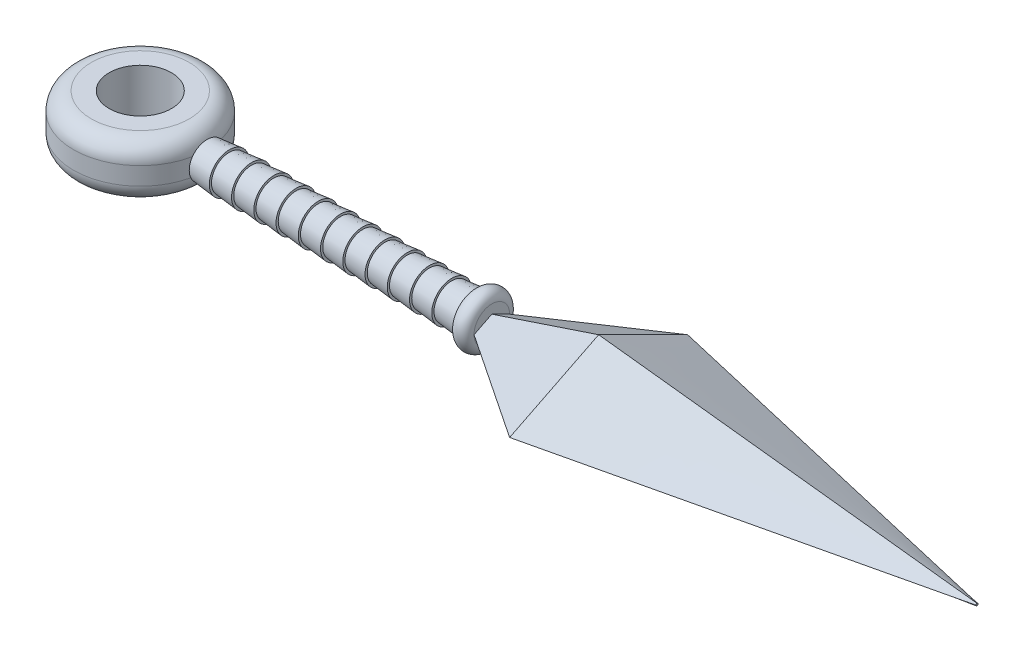
from build123d import *

# Parameters (mm, degrees)
SKETCH1_R           = 15
SKETCH1_R_2         = 7
BOSS_EXTRUDE1_DEPTH = 6
FILLET1_R           = 4


with BuildPart() as part:
    # Sketch1 → Boss-Extrude1 (new, symmetric)
    with BuildSketch(Plane(origin=(0, 0, 0), x_dir=(1, 0, 0), z_dir=(0, 1, 0))):
        with Locations(Location((0, 0, 0), (0, 0, 270))):
            Circle(SKETCH1_R)
        with Locations(Location((0, 0, 0), (0, 0, 270))):
            Circle(SKETCH1_R_2, mode=Mode.SUBTRACT)
    extrude(amount=BOSS_EXTRUDE1_DEPTH, both=True)

    # Fillet1
    fillet1_edges = [part.edges().sort_by_distance(p)[0] for p in [
        (0, -6, -15),
        (0, 6, -15),
    ]]
    fillet(fillet1_edges, radius=FILLET1_R)


with BuildPart() as body_2:
    # Sketch2 → Revolve1 (revolve)
    with BuildSketch(Plane.XY, mode=Mode.PRIVATE) as revolve1_sk:
        Polygon((20, 0), (20, 4.5), (15, 4), (15, 0), align=None)
        with BuildLine():
            Line((75, 0), (75, 4))
            ThreePointArc((75, 4), (77, 6), (79, 4))
            Line((79, 4), (79, 0))
            Line((79, 0), (75, 0))
        make_face()
    revolve(revolve1_sk.sketch.rotate(Axis((15, 0, 0), (1, 0, 0)), 90), axis=Axis((15, 0, 0), (1, 0, 0)))

    # Sketch6 → Loft1 section 0
    with BuildSketch(Plane(origin=(79, 0, 0), x_dir=(0, 0, -1), z_dir=(1, 0, 0))):
        with BuildLine():
            Line((0, 2), (-4, 0))
            Line((-4, 0), (0, -2))
            Line((0, -2), (4, 0))
            Line((4, 0), (0, 2))
        make_face()
    # Sketch5 → Loft1 section 1
    with BuildSketch(Plane(origin=(103, 0, 0), x_dir=(0, 0, -1), z_dir=(1, 0, 0))):
        with BuildLine():
            Line((0, 10), (-20, 0))
            Line((-20, 0), (0, -10))
            Line((0, -10), (20, 0))
            Line((20, 0), (0, 10))
        make_face()
    loft()

    # Loft3: read off the stored shape, not the designer's step
    # Loft3: loft between two sections, ruled curve by curve
    loft3_from = [
        Edge.make_bspline([(188, 0, -0.25), (188, -0.058925565, -0.25), (188, -0.127961159, -0.225592232), (188, -0.225592232, -0.127961159), (188, -0.25, -0.058925565), (188, -0.25, 0)], [0, 0, 0, 0, 0.5, 0.5, 1, 1, 1, 1], 3),
        Edge.make_bspline([(188, -0.25, 0), (188, -0.25, 0.058925565), (188, -0.225592232, 0.127961159), (188, -0.127961159, 0.225592232), (188, -0.058925565, 0.25), (188, 0, 0.25)], [0, 0, 0, 0, 0.5, 0.5, 1, 1, 1, 1], 3),
        Edge.make_bspline([(188, 0.25, 0), (188, 0.25, -0.058925565), (188, 0.225592232, -0.127961159), (188, 0.127961159, -0.225592232), (188, 0.058925565, -0.25), (188, 0, -0.25)], [0, 0, 0, 0, 0.5, 0.5, 1, 1, 1, 1], 3),
        Edge.make_bspline([(188, 0, 0.25), (188, 0.058925565, 0.25), (188, 0.127961159, 0.225592232), (188, 0.225592232, 0.127961159), (188, 0.25, 0.058925565), (188, 0.25, 0)], [0, 0, 0, 0, 0.5, 0.5, 1, 1, 1, 1], 3),
    ]
    loft3_to = [
        Edge.make_bspline([(103, 0, -20), (103, -1.666666667, -16.666666667), (103, -3.333333333, -13.333333333), (103, -6.666666667, -6.666666667), (103, -8.333333333, -3.333333333), (103, -10, 0)], [0, 0, 0, 0, 0.5, 0.5, 1, 1, 1, 1], 3),
        Edge.make_bspline([(103, -10, 0), (103, -8.333333333, 3.333333333), (103, -6.666666667, 6.666666667), (103, -3.333333333, 13.333333333), (103, -1.666666667, 16.666666667), (103, 0, 20)], [0, 0, 0, 0, 0.5, 0.5, 1, 1, 1, 1], 3),
        Edge.make_bspline([(103, 10, 0), (103, 8.333333333, -3.333333333), (103, 6.666666667, -6.666666667), (103, 3.333333333, -13.333333333), (103, 1.666666667, -16.666666667), (103, 0, -20)], [0, 0, 0, 0, 0.5, 0.5, 1, 1, 1, 1], 3),
        Edge.make_bspline([(103, 0, 20), (103, 1.666666667, 16.666666667), (103, 3.333333333, 13.333333333), (103, 6.666666667, 6.666666667), (103, 8.333333333, 3.333333333), (103, 10, 0)], [0, 0, 0, 0, 0.5, 0.5, 1, 1, 1, 1], 3),
    ]
    loft3 = Solid(Shell([*[Face.make_surface_from_curves(loft3_from[k], loft3_to[k]) for k in range(4)], Face(Wire(loft3_from)), Face(Wire(loft3_to))]))
    add(loft3)


with BuildPart() as body_3:
    # LPattern1: read off the stored shape, not the designer's step
    # LPattern1 outline → LPattern1 (revolve)
    with BuildSketch(Plane.YX):
        Polygon((4.5, 75), (0, 75), (0, 70), (4, 70), align=None)
    revolve(axis=Axis((0, 0, 0), (1, 0, 0)))


with BuildPart() as body_4:
    # LPattern1 2 outline → LPattern1 2 (revolve)
    with BuildSketch(Plane.YX):
        Polygon((4.5, 70), (0, 70), (0, 65), (4, 65), align=None)
    revolve(axis=Axis((0, 0, 0), (1, 0, 0)))


with BuildPart() as body_5:
    # LPattern1 3 outline → LPattern1 3 (revolve)
    with BuildSketch(Plane.YX):
        Polygon((4.5, 65), (0, 65), (0, 60), (4, 60), align=None)
    revolve(axis=Axis((0, 0, 0), (1, 0, 0)))


with BuildPart() as body_6:
    # LPattern1 4 outline → LPattern1 4 (revolve)
    with BuildSketch(Plane.YX):
        Polygon((4.5, 60), (0, 60), (0, 55), (4, 55), align=None)
    revolve(axis=Axis((0, 0, 0), (1, 0, 0)))


with BuildPart() as body_7:
    # LPattern1 5 outline → LPattern1 5 (revolve)
    with BuildSketch(Plane.YX):
        Polygon((4.5, 55), (0, 55), (0, 50), (4, 50), align=None)
    revolve(axis=Axis((0, 0, 0), (1, 0, 0)))


with BuildPart() as body_8:
    # LPattern1 6 outline → LPattern1 6 (revolve)
    with BuildSketch(Plane.YX):
        Polygon((4.5, 50), (0, 50), (0, 45), (4, 45), align=None)
    revolve(axis=Axis((0, 0, 0), (1, 0, 0)))


with BuildPart() as body_9:
    # LPattern1 7 outline → LPattern1 7 (revolve)
    with BuildSketch(Plane.YX):
        Polygon((4.5, 45), (0, 45), (0, 40), (4, 40), align=None)
    revolve(axis=Axis((0, 0, 0), (1, 0, 0)))


with BuildPart() as body_10:
    # LPattern1 8 outline → LPattern1 8 (revolve)
    with BuildSketch(Plane.YX):
        Polygon((4.5, 40), (0, 40), (0, 35), (4, 35), align=None)
    revolve(axis=Axis((0, 0, 0), (1, 0, 0)))


with BuildPart() as body_11:
    # LPattern1 9 outline → LPattern1 9 (revolve)
    with BuildSketch(Plane.YX):
        Polygon((4.5, 35), (0, 35), (0, 30), (4, 30), align=None)
    revolve(axis=Axis((0, 0, 0), (1, 0, 0)))


with BuildPart() as body_12:
    # LPattern1 10 outline → LPattern1 10 (revolve)
    with BuildSketch(Plane.YX):
        Polygon((4.5, 30), (0, 30), (0, 25), (4, 25), align=None)
    revolve(axis=Axis((0, 0, 0), (1, 0, 0)))


with BuildPart() as body_13:
    # LPattern1 11 outline → LPattern1 11 (revolve)
    with BuildSketch(Plane.YX):
        Polygon((4.5, 25), (0, 25), (0, 20), (4, 20), align=None)
    revolve(axis=Axis((0, 0, 0), (1, 0, 0)))


solid = Compound([part.part, body_2.part, body_3.part, body_4.part, body_5.part, body_6.part, body_7.part, body_8.part, body_9.part, body_10.part, body_11.part, body_12.part, body_13.part])
